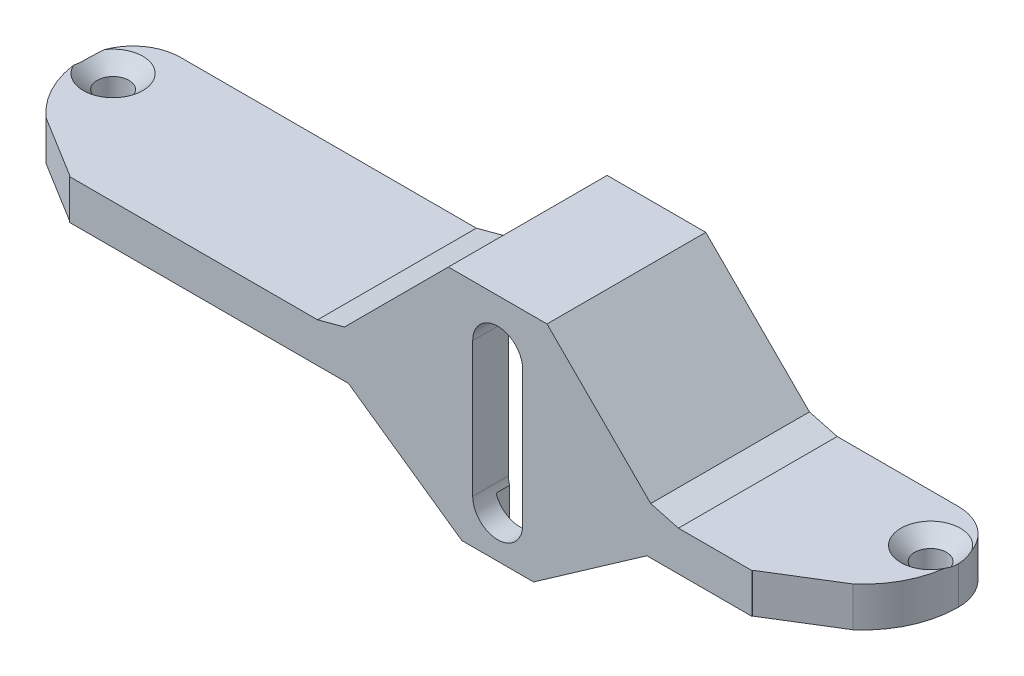
from build123d import *

# Parameters (mm, degrees)
BOSS_EXTRUDE1_DEPTH           = 3
CUT_EXTRUDE1_DEPTH            = 10
CUT_EXTRUDE3_START            = 8
SKETCH8_W                     = 6
SKETCH8_H                     = 3
CUT_EXTRUDE3_DEPTH            = 6
BOSS_EXTRUDE4_START           = 18
BOSS_EXTRUDE4_DEPTH           = 28
BOSS_EXTRUDE5_DEPTH           = 3
CUT_EXTRUDE4_DEPTH            = 3
CUT_EXTRUDE5_DEPTH            = 10
SKETCH18_R                    = 1.5
BOSS_EXTRUDE9_DEPTH           = 2
CHAMFER1_SIZE                 = 15
CHAMFER2_SIZE                 = 15
CHAMFER2_SIZE_2               = 10.503113073
CUT_EXTRUDE6_DEPTH            = 5
BOSS_EXTRUDE8_DEPTH           = 2
CHAMFER3_DEPTH                = 6
CHAMFER3_2_DEPTH              = 5
CSK_FOR_M4_SFHCS1_D           = 4
CSK_FOR_M4_SFHCS1_DEPTH       = 30.798278762
CSK_FOR_M4_SFHCS1_CSINK_D     = 7.5
CSK_FOR_M4_SFHCS1_CSINK_ANGLE = 90
CSK_FOR_M4_SFHCS1_TIP         = 1.201721238
CUT_EXTRUDE7_DEPTH            = 1.5
BOSS_EXTRUDE10_START          = -6
BOSS_EXTRUDE10_DEPTH          = 20
CHAMFER4_SIZE                 = 1.07179677
CHAMFER4_SIZE_2               = 4


with BuildPart() as part:
    # Sketch1 → Boss-Extrude1 (new body)
    with BuildSketch(Plane(origin=(0, 0, 0), x_dir=(1, 0, 0), z_dir=(0, 1, 0))):
        with BuildLine():
            ThreePointArc((-49, -6), (-53.242640687, -4.242640687), (-55, 0))
            ThreePointArc((-55, 0), (-51.485281374, -8.485281374), (-43, -12))
            Line((-43, -12), (43, -12))
            ThreePointArc((43, -12), (51.485281374, -8.485281374), (55, 0))
            ThreePointArc((55, 0), (53.242640687, -4.242640687), (49, -6))
            Line((49, -6), (-49, -6))
        make_face()
        with BuildLine():
            Line((-53, 0), (-55, 0))
            ThreePointArc((-55, 0), (-53.242640687, -4.242640687), (-49, -6))
            Line((-49, -6), (49, -6))
            ThreePointArc((49, -6), (53.242640687, -4.242640687), (55, 0))
            Line((55, 0), (53, 0))
            ThreePointArc((53, 0), (51.5, -1.5), (50, 0))
            Line((50, 0), (-50, 0))
            ThreePointArc((-50, 0), (-51.5, -1.5), (-53, 0))
        make_face()
        with BuildLine():
            Line((49, 6), (-49, 6))
            ThreePointArc((-49, 6), (-53.242640687, 4.242640687), (-55, 0))
            Line((-55, 0), (-53, 0))
            ThreePointArc((-53, 0), (-51.5, 1.5), (-50, 0))
            Line((-50, 0), (50, 0))
            ThreePointArc((50, 0), (51.5, 1.5), (53, 0))
            Line((53, 0), (55, 0))
            ThreePointArc((55, 0), (53.242640687, 4.242640687), (49, 6))
        make_face()
    extrude(amount=BOSS_EXTRUDE1_DEPTH)

    # Sketch2 → Cut-Extrude1 (cut)
    with BuildSketch(Plane(origin=(0, 3, 0), x_dir=(1, 0, 0), z_dir=(0, 1, 0))):
        Polygon((22, -8), (36, 6), (-14, 6), (0, -8), align=None)
    extrude(amount=-CUT_EXTRUDE1_DEPTH, mode=Mode.SUBTRACT)

    # Sketch8 → Cut-Extrude3 (cut)
    with BuildSketch(Plane.XY.offset(CUT_EXTRUDE3_START)):
        with Locations((10.960071178, 1.5)):
            Rectangle(SKETCH8_W, SKETCH8_H)
    extrude(amount=CUT_EXTRUDE3_DEPTH, mode=Mode.SUBTRACT)


with BuildPart() as cut_extrude3_piece_1:
    # of the separate pieces the step leaves, piece 1, a body of its own (cut_extrude3_pieces)
    add(part.part.solids().sort_by_distance((-55, 0, 0))[0])

    # Sketch9 → Boss-Extrude4 (add)
    with BuildSketch(Plane(origin=(0, 0, 0), x_dir=(1, 0, 0), z_dir=(0, 1, 0)).offset(BOSS_EXTRUDE4_START)):
        Polygon((13.960071178, -11.2), (13.960071178, -8), (14.760071178, -8), (14.760071178, -12), (7.160071178, -12), (7.160071178, -8), (7.960071178, -8), (7.960071178, -11.2), align=None)
    extrude(amount=-BOSS_EXTRUDE4_DEPTH)


with BuildPart() as cut_extrude3_piece_2:
    # of the separate pieces the step leaves, piece 2, a body of its own (cut_extrude3_pieces)
    add(part.part.solids().sort_by_distance((13.960071178, 0, 12))[0])


with BuildPart() as cut_extrude3_piece_1_1:
    add(cut_extrude3_piece_1.part)

    # Combine1: union Cut-Extrude3 piece 2
    add(cut_extrude3_piece_2.part)

    # Sketch11 → Boss-Extrude5 (add)
    with BuildSketch(Plane(origin=(0, 3, 0), x_dir=(1, 0, 0), z_dir=(0, 1, 0))):
        Polygon((-14, 6), (-12, 6), (2, -8), (0, -8), align=None)
        Polygon((20, -8), (34, 6), (36, 6), (22, -8), align=None)
    extrude(amount=-BOSS_EXTRUDE5_DEPTH)

    # Sketch13 → Cut-Extrude4 (cut)
    with BuildSketch(Plane(origin=(0, 3, 0), x_dir=(1, 0, 0), z_dir=(0, 1, 0))):
        Polygon((2, -8), (-2, -8), (-2, -4), align=None)
        Polygon((24, -4), (24, -8), (20, -8), align=None)
    extrude(amount=-CUT_EXTRUDE4_DEPTH, mode=Mode.SUBTRACT)

    # Sketch15 → Cut-Extrude5 (cut)
    with BuildSketch(Plane.XY.offset(12)):
        with BuildLine():
            Line((14.110071178, 12.5), (14.110071178, -4.5))
            ThreePointArc((14.110071178, -4.5), (10.960071178, -7.65), (7.810071178, -4.5))
            Line((7.810071178, -4.5), (7.810071178, 12.5))
            ThreePointArc((7.810071178, 12.5), (10.960071178, 15.65), (14.110071178, 12.5))
        make_face()
    extrude(amount=-CUT_EXTRUDE5_DEPTH, mode=Mode.SUBTRACT)

    # Sketch18 → Boss-Extrude9 (add)
    # profile 1 of 2: a face of its own
    with BuildSketch(Plane(origin=(0, 3, 0), x_dir=(1, 0, 0), z_dir=(0, 1, 0))):
        with BuildLine():
            Line((7.160071178, -8), (-2, -8))
            Line((-2, -8), (-2, -4))
            Line((-2, -4), (-12, 6))
            Line((-12, 6), (-49, 6))
            ThreePointArc((-49, 6), (-53.242640687, 4.242640687), (-55, 0))
            ThreePointArc((-55, 0), (-51.485281374, -8.485281374), (-43, -12))
            Line((-43, -12), (7.160071178, -12))
            Line((7.160071178, -12), (7.160071178, -8))
        make_face()
        with Locations(Location((-51.5, 0, 0), (0, 0, 270))):
            Circle(SKETCH18_R, mode=Mode.SUBTRACT)
    # profile 2 of 2: a face of its own
    with BuildSketch(Plane(origin=(0, 3, 0), x_dir=(1, 0, 0), z_dir=(0, 1, 0))):
        with BuildLine():
            Line((24, -4), (24, -8))
            Line((24, -8), (14.760071178, -8))
            Line((14.760071178, -8), (14.760071178, -12))
            Line((14.760071178, -12), (43, -12))
            ThreePointArc((43, -12), (51.485281374, -8.485281374), (55, 0))
            ThreePointArc((55, 0), (53.242640687, 4.242640687), (49, 6))
            Line((49, 6), (34, 6))
            Line((34, 6), (24, -4))
        make_face()
        with Locations(Location((51.5, 0, 0), (0, 0, 270))):
            Circle(SKETCH18_R, mode=Mode.SUBTRACT)
    extrude(amount=BOSS_EXTRUDE9_DEPTH)

    # Chamfer1
    # the kernel refuses this chamfer: 15 mm, written as the material it adds along each edge
    with BuildSketch(Plane(origin=(14.760071178, 5, 8), x_dir=(0, 1, 0), z_dir=(0, 0, 1))) as chamfer1_piece_1_section:
        Polygon((CHAMFER1_SIZE, 0), (0, -CHAMFER1_SIZE), (0, 0), align=None)
    chamfer1_piece_1 = extrude(amount=4, mode=Mode.PRIVATE)
    chamfer1_piece_1 = split(chamfer1_piece_1, bisect_by=Plane(origin=(14.760071178, 18, 8), z_dir=(0, -1, 0)), keep=Keep.TOP, mode=Mode.PRIVATE)
    chamfer1_piece_1 = split(chamfer1_piece_1, bisect_by=Plane(origin=(17.380035589, 5, 10.619964411), z_dir=(-0.7071067811865474, 0, -0.7071067811865477)), keep=Keep.TOP, mode=Mode.PRIVATE)
    add(chamfer1_piece_1)
    with BuildSketch(Plane(origin=(14.760071178, 5, -30.575244819), x_dir=(0, 1, 0), z_dir=(0, 0, 1))) as chamfer1_piece_2_section:
        Polygon((CHAMFER1_SIZE, 0), (0, -CHAMFER1_SIZE), (0, 0), align=None)
    chamfer1_piece_2 = extrude(amount=42.575244819, mode=Mode.PRIVATE)
    chamfer1_piece_2 = split(chamfer1_piece_2, bisect_by=Plane(origin=(14.760071178, 5, 8), z_dir=(0, 0, -1)), keep=Keep.TOP, mode=Mode.PRIVATE)
    chamfer1_piece_2 = split(chamfer1_piece_2, bisect_by=Plane(origin=(36.667657999, 5, -8.667657999), z_dir=(0.7071067811865474, 0, 0.7071067811865477)), keep=Keep.TOP, mode=Mode.PRIVATE)
    chamfer1_piece_2 = split(chamfer1_piece_2, bisect_by=Plane(origin=(24, 5, -30.575244819), z_dir=(1, 0, 0)), keep=Keep.TOP, mode=Mode.PRIVATE)
    add(chamfer1_piece_2)
    with BuildSketch(Plane(origin=(14.760071178, 5, 8), x_dir=(0, 1, 0), z_dir=(0, 0, 1))) as chamfer1_piece_3_section:
        Polygon((CHAMFER1_SIZE, 0), (0, -CHAMFER1_SIZE), (0, 0), align=None)
    chamfer1_piece_3 = extrude(amount=4, mode=Mode.PRIVATE)
    chamfer1_piece_3 = split(chamfer1_piece_3, bisect_by=Plane(origin=(14.760071178, 18, 8), z_dir=(0, -1, 0)), keep=Keep.TOP, mode=Mode.PRIVATE)
    chamfer1_piece_3 = split(chamfer1_piece_3, bisect_by=Plane(origin=(17.380035589, 5, 10.619964411), z_dir=(0.7071067811865474, 0, 0.7071067811865477)), keep=Keep.TOP, mode=Mode.PRIVATE)
    chamfer1_piece_3 = split(chamfer1_piece_3, bisect_by=Plane(origin=(24, 5, 8), z_dir=(-1, 0, 0)), keep=Keep.TOP, mode=Mode.PRIVATE)
    add(chamfer1_piece_3)
    with BuildSketch(Plane(origin=(14.760071178, 5, 8), x_dir=(0, 1, 0), z_dir=(0, 0, 1))) as chamfer1_piece_4_section:
        Polygon((CHAMFER1_SIZE, 0), (0, -CHAMFER1_SIZE), (0, 0), align=None)
    chamfer1_piece_4 = extrude(amount=4, mode=Mode.PRIVATE)
    chamfer1_piece_4 = split(chamfer1_piece_4, bisect_by=Plane(origin=(24, 5, 8), z_dir=(1, 0, 0)), keep=Keep.TOP, mode=Mode.PRIVATE)
    add(chamfer1_piece_4)
    with BuildSketch(Plane(origin=(7.160071178, 5, 12), x_dir=(0, 1, 0), z_dir=(0, 0, -1))) as chamfer1_piece_5_section:
        Polygon((CHAMFER1_SIZE, 0), (0, -CHAMFER1_SIZE), (0, 0), align=None)
    chamfer1_piece_5 = extrude(amount=4, mode=Mode.PRIVATE)
    chamfer1_piece_5 = split(chamfer1_piece_5, bisect_by=Plane(origin=(6.580035589, 5, 12.580035589), z_dir=(-0.7071067811865489, 0, 0.7071067811865461)), keep=Keep.TOP, mode=Mode.PRIVATE)
    chamfer1_piece_5 = split(chamfer1_piece_5, bisect_by=Plane(origin=(-2, 5, 12), z_dir=(1, 0, 0)), keep=Keep.TOP, mode=Mode.PRIVATE)
    chamfer1_piece_5 = split(chamfer1_piece_5, bisect_by=Plane(origin=(7.160071178, 18, 12), z_dir=(0, -1, 0)), keep=Keep.TOP, mode=Mode.PRIVATE)
    add(chamfer1_piece_5)
    with BuildSketch(Plane(origin=(7.160071178, 5, 12), x_dir=(0, 1, 0), z_dir=(0, 0, -1))) as chamfer1_piece_6_section:
        Polygon((CHAMFER1_SIZE, 0), (0, -CHAMFER1_SIZE), (0, 0), align=None)
    chamfer1_piece_6 = extrude(amount=4, mode=Mode.PRIVATE)
    chamfer1_piece_6 = split(chamfer1_piece_6, bisect_by=Plane(origin=(-2, 5, 12), z_dir=(-1, 0, 0)), keep=Keep.TOP, mode=Mode.PRIVATE)
    add(chamfer1_piece_6)
    with BuildSketch(Plane(origin=(7.160071178, 5, 12), x_dir=(0, 1, 0), z_dir=(0, 0, -1))) as chamfer1_piece_7_section:
        Polygon((CHAMFER1_SIZE, 0), (0, -CHAMFER1_SIZE), (0, 0), align=None)
    chamfer1_piece_7 = extrude(amount=4, mode=Mode.PRIVATE)
    chamfer1_piece_7 = split(chamfer1_piece_7, bisect_by=Plane(origin=(6.580035589, 5, 12.580035589), z_dir=(0.7071067811865489, 0, -0.7071067811865461)), keep=Keep.TOP, mode=Mode.PRIVATE)
    chamfer1_piece_7 = split(chamfer1_piece_7, bisect_by=Plane(origin=(7.160071178, 18, 12), z_dir=(0, -1, 0)), keep=Keep.TOP, mode=Mode.PRIVATE)
    add(chamfer1_piece_7)
    with BuildSketch(Plane(origin=(7.160071178, 5, 12), x_dir=(0, 1, 0), z_dir=(0, 0, -1))) as chamfer1_piece_8_section:
        Polygon((CHAMFER1_SIZE, 0), (0, -CHAMFER1_SIZE), (0, 0), align=None)
    chamfer1_piece_8 = extrude(amount=42.575244819, mode=Mode.PRIVATE)
    chamfer1_piece_8 = split(chamfer1_piece_8, bisect_by=Plane(origin=(6.580035589, 5, 12.580035589), z_dir=(-0.7071067811865489, 0, 0.7071067811865461)), keep=Keep.TOP, mode=Mode.PRIVATE)
    chamfer1_piece_8 = split(chamfer1_piece_8, bisect_by=Plane(origin=(-2, 5, 12), z_dir=(-1, 0, 0)), keep=Keep.TOP, mode=Mode.PRIVATE)
    chamfer1_piece_8 = split(chamfer1_piece_8, bisect_by=Plane(origin=(7.160071178, 5, 8), z_dir=(0, 0, -1)), keep=Keep.TOP, mode=Mode.PRIVATE)
    add(chamfer1_piece_8)

    # Chamfer2
    # the kernel refuses this chamfer: 15, 10.503113073 mm, written as the material it adds along each edge
    with BuildSketch(Plane(origin=(7.160071178, 0, 12), x_dir=(-1, 0, 0), z_dir=(0, 0, -1))) as chamfer2_piece_1_section:
        Polygon((CHAMFER2_SIZE, 0), (0, -CHAMFER2_SIZE_2), (0, 0), align=None)
    chamfer2_piece_1 = extrude(amount=4, mode=Mode.PRIVATE)
    chamfer2_piece_1 = split(chamfer2_piece_1, bisect_by=Plane(origin=(-2, 0, 12), z_dir=(-1, 0, 0)), keep=Keep.TOP, mode=Mode.PRIVATE)
    add(chamfer2_piece_1)
    with BuildSketch(Plane(origin=(7.160071178, 0, 12), x_dir=(-1, 0, 0), z_dir=(0, 0, -1))) as chamfer2_piece_2_section:
        Polygon((CHAMFER2_SIZE, 0), (0, -CHAMFER2_SIZE_2), (0, 0), align=None)
    chamfer2_piece_2 = extrude(amount=4, mode=Mode.PRIVATE)
    chamfer2_piece_2 = split(chamfer2_piece_2, bisect_by=Plane(origin=(6.580035589, 0, 12.580035589), z_dir=(-0.7071067811865476, 0, 0.7071067811865476)), keep=Keep.TOP, mode=Mode.PRIVATE)
    chamfer2_piece_2 = split(chamfer2_piece_2, bisect_by=Plane(origin=(-2, 0, 12), z_dir=(1, 0, 0)), keep=Keep.TOP, mode=Mode.PRIVATE)
    add(chamfer2_piece_2)
    with BuildSketch(Plane(origin=(7.160071178, 0, 12), x_dir=(-1, 0, 0), z_dir=(0, 0, -1))) as chamfer2_piece_3_section:
        Polygon((CHAMFER2_SIZE, 0), (0, -CHAMFER2_SIZE_2), (0, 0), align=None)
    chamfer2_piece_3 = extrude(amount=42.738283454, mode=Mode.PRIVATE)
    chamfer2_piece_3 = split(chamfer2_piece_3, bisect_by=Plane(origin=(6.580035589, 0, 12.580035589), z_dir=(-0.7071067811865476, 0, 0.7071067811865476)), keep=Keep.TOP, mode=Mode.PRIVATE)
    chamfer2_piece_3 = split(chamfer2_piece_3, bisect_by=Plane(origin=(7.160071178, 0, 8), z_dir=(0, 0, -1)), keep=Keep.TOP, mode=Mode.PRIVATE)
    chamfer2_piece_3 = split(chamfer2_piece_3, bisect_by=Plane(origin=(-2, 0, 12), z_dir=(-1, 0, 0)), keep=Keep.TOP, mode=Mode.PRIVATE)
    add(chamfer2_piece_3)
    with BuildSketch(Plane(origin=(7.160071178, 0, 12), x_dir=(-1, 0, 0), z_dir=(0, 0, -1))) as chamfer2_piece_4_section:
        Polygon((CHAMFER2_SIZE, 0), (0, -CHAMFER2_SIZE_2), (0, 0), align=None)
    chamfer2_piece_4 = extrude(amount=4, mode=Mode.PRIVATE)
    chamfer2_piece_4 = split(chamfer2_piece_4, bisect_by=Plane(origin=(6.580035589, 0, 12.580035589), z_dir=(0.7071067811865476, 0, -0.7071067811865476)), keep=Keep.TOP, mode=Mode.PRIVATE)
    chamfer2_piece_4 = split(chamfer2_piece_4, bisect_by=Plane(origin=(7.160071178, -10, 12), z_dir=(0, 1, 0)), keep=Keep.TOP, mode=Mode.PRIVATE)
    add(chamfer2_piece_4)
    with BuildSketch(Plane(origin=(14.760071178, 0, 12), x_dir=(0, -1, 0), z_dir=(0, 0, -1))) as chamfer2_piece_5_section:
        Polygon((CHAMFER2_SIZE_2, 0), (0, -CHAMFER2_SIZE), (0, 0), align=None)
    chamfer2_piece_5 = extrude(amount=4, mode=Mode.PRIVATE)
    chamfer2_piece_5 = split(chamfer2_piece_5, bisect_by=Plane(origin=(15.380035589, 0, 12.619964411), z_dir=(0.7071067811865476, 0, 0.7071067811865476)), keep=Keep.TOP, mode=Mode.PRIVATE)
    chamfer2_piece_5 = split(chamfer2_piece_5, bisect_by=Plane(origin=(24, 0, 12), z_dir=(-1, 0, 0)), keep=Keep.TOP, mode=Mode.PRIVATE)
    add(chamfer2_piece_5)
    with BuildSketch(Plane(origin=(14.760071178, 0, 12), x_dir=(0, -1, 0), z_dir=(0, 0, -1))) as chamfer2_piece_6_section:
        Polygon((CHAMFER2_SIZE_2, 0), (0, -CHAMFER2_SIZE), (0, 0), align=None)
    chamfer2_piece_6 = extrude(amount=4, mode=Mode.PRIVATE)
    chamfer2_piece_6 = split(chamfer2_piece_6, bisect_by=Plane(origin=(24, 0, 12), z_dir=(1, 0, 0)), keep=Keep.TOP, mode=Mode.PRIVATE)
    add(chamfer2_piece_6)
    with BuildSketch(Plane(origin=(14.760071178, 0, 12), x_dir=(0, -1, 0), z_dir=(0, 0, -1))) as chamfer2_piece_7_section:
        Polygon((CHAMFER2_SIZE_2, 0), (0, -CHAMFER2_SIZE), (0, 0), align=None)
    chamfer2_piece_7 = extrude(amount=4, mode=Mode.PRIVATE)
    chamfer2_piece_7 = split(chamfer2_piece_7, bisect_by=Plane(origin=(14.760071178, -10, 12), z_dir=(0, 1, 0)), keep=Keep.TOP, mode=Mode.PRIVATE)
    chamfer2_piece_7 = split(chamfer2_piece_7, bisect_by=Plane(origin=(15.380035589, 0, 12.619964411), z_dir=(-0.7071067811865476, 0, -0.7071067811865476)), keep=Keep.TOP, mode=Mode.PRIVATE)
    add(chamfer2_piece_7)
    with BuildSketch(Plane(origin=(14.760071178, 0, 12), x_dir=(0, -1, 0), z_dir=(0, 0, -1))) as chamfer2_piece_8_section:
        Polygon((CHAMFER2_SIZE_2, 0), (0, -CHAMFER2_SIZE), (0, 0), align=None)
    chamfer2_piece_8 = extrude(amount=42.738283454, mode=Mode.PRIVATE)
    chamfer2_piece_8 = split(chamfer2_piece_8, bisect_by=Plane(origin=(14.760071178, 0, 8), z_dir=(0, 0, -1)), keep=Keep.TOP, mode=Mode.PRIVATE)
    chamfer2_piece_8 = split(chamfer2_piece_8, bisect_by=Plane(origin=(15.380035589, 0, 12.619964411), z_dir=(0.7071067811865476, 0, 0.7071067811865476)), keep=Keep.TOP, mode=Mode.PRIVATE)
    chamfer2_piece_8 = split(chamfer2_piece_8, bisect_by=Plane(origin=(24, 0, 12), z_dir=(1, 0, 0)), keep=Keep.TOP, mode=Mode.PRIVATE)
    add(chamfer2_piece_8)

    # Sketch16 → Cut-Extrude6 (cut)
    with BuildSketch(Plane(origin=(0, 0, 0), x_dir=(1, 0, 0), z_dir=(0, 1, 0))):
        Polygon((-7.839928822, 1.839928822), (-2, -4), (-2, -8), (-7.839928822, -8), align=None)
        Polygon((24, -8), (24, -4), (29.760071178, 1.760071178), (29.760071178, -8), align=None)
    extrude(amount=-CUT_EXTRUDE6_DEPTH, mode=Mode.SUBTRACT)

    # Sketch17 → Boss-Extrude8 (add)
    with BuildSketch(Plane.XY.offset(12)):
        Polygon((6.441551245, -10), (15.47859111, -10), (29.760071178, 0), (43, 0), (43, 5), (29.760071178, 5), (16.760071178, 18), (5.160071178, 18), (-7.839928822, 5), (-43, 5), (-43, 0), (-7.839928822, 0), align=None)
        with BuildLine():
            Line((7.810071178, 12.5), (7.810071178, -4.5))
            ThreePointArc((7.810071178, -4.5), (10.960071178, -7.65), (14.110071178, -4.5))
            Line((14.110071178, -4.5), (14.110071178, 12.5))
            ThreePointArc((14.110071178, 12.5), (10.960071178, 15.65), (7.810071178, 12.5))
        make_face(mode=Mode.SUBTRACT)
    extrude(amount=BOSS_EXTRUDE8_DEPTH)

    # Chamfer3: read off the stored shape, not the designer's step
    # Chamfer3 outline → Chamfer3 (cut)
    with BuildSketch(Plane(origin=(0, 0, 0), x_dir=(1, 0, 0), z_dir=(0, 1, 0))):
        with BuildLine():
            ThreePointArc((47.608318931, -11.079864468), (49.300429772, -10.212961602), (50.834384089, -9.08968789))
            Line((50.834384089, -9.08968789), (47.608318931, -11.079864468))
        make_face()
        with BuildLine():
            ThreePointArc((-50.834384089, -9.08968789), (-49.300429772, -10.212961602), (-47.608318931, -11.079864468))
            Line((-47.608318931, -11.079864468), (-50.834384089, -9.08968789))
        make_face()
    extrude(amount=CHAMFER3_DEPTH, mode=Mode.SUBTRACT)

    # Chamfer3 2 outline → Chamfer3 2 (add)
    with BuildSketch(Plane(origin=(0, 0, 0), x_dir=(1, 0, 0), z_dir=(0, 1, 0))):
        with BuildLine():
            Line((43, -13.922760673), (47.608318931, -11.079864468))
            ThreePointArc((47.608318931, -11.079864468), (45.349641077, -11.767717995), (43, -12))
            Line((43, -12), (43, -13.922760673))
        make_face()
        with BuildLine():
            Line((-47.608318931, -11.079864468), (-43, -13.922760673))
            Line((-43, -13.922760673), (-43, -12))
            ThreePointArc((-43, -12), (-45.349641077, -11.767717995), (-47.608318931, -11.079864468))
        make_face()
    extrude(amount=CHAMFER3_2_DEPTH)

    # CSK for M4 SFHCS1
    with Locations(Plane(origin=(0, 5, 0), x_dir=(1, 0, 0), z_dir=(0, 1, 0))):
        with Locations((-51.5, 0), (51.5, 0)):
            CounterSinkHole(CSK_FOR_M4_SFHCS1_D / 2, CSK_FOR_M4_SFHCS1_CSINK_D / 2, depth=CSK_FOR_M4_SFHCS1_DEPTH, counter_sink_angle=CSK_FOR_M4_SFHCS1_CSINK_ANGLE)
            with Locations((0, 0, -(CSK_FOR_M4_SFHCS1_DEPTH + CSK_FOR_M4_SFHCS1_TIP / 2))):  # 118° drill point
                Cone(0, CSK_FOR_M4_SFHCS1_D / 2, CSK_FOR_M4_SFHCS1_TIP, mode=Mode.SUBTRACT)

    # Sketch21 → Cut-Extrude7 (cut)
    with BuildSketch(Plane(origin=(0, 0, 8), x_dir=(-1, 0, 0), z_dir=(0, 0, -1))):
        Polygon((-13.960071178, -10), (-13.960071178, 18), (-16.760071178, 18), (-16.760071178, -9.102697997), (-15.47859111, -10), align=None)
        Polygon((-7.960071178, -10), (-7.960071178, 18), (-5.160071178, 18), (-5.160071178, -9.102697997), (-6.441551245, -10), align=None)
    extrude(amount=-CUT_EXTRUDE7_DEPTH, mode=Mode.SUBTRACT)

    # Sketch22 → Boss-Extrude10 (add)
    with BuildSketch(Plane.XY.offset(BOSS_EXTRUDE10_START)):
        Polygon((34, 3), (28.931644053, 3), (15.931644053, 16), (5.988498302, 16), (-7.011501698, 3), (-12, 3), (-12, 6), (-8.254142385, 6), (4.745857615, 19), (17.17428474, 19), (30.17428474, 6), (34, 6), align=None)
    extrude(amount=BOSS_EXTRUDE10_DEPTH)

    # Chamfer4
    # the kernel refuses this chamfer: 4, 1.07179677 mm, written as the material it takes off along each edge
    with BuildSketch(Plane(origin=(-12, 6, -16.386886281), x_dir=(0, -1, 0), z_dir=(0, 0, 1))) as chamfer4_piece_1_section:
        Polygon((CHAMFER4_SIZE, 0), (0, CHAMFER4_SIZE_2), (0, 0), align=None)
    chamfer4_piece_1 = extrude(amount=40.773772562, mode=Mode.PRIVATE)
    chamfer4_piece_1 = split(chamfer4_piece_1, bisect_by=Plane(origin=(-12, 5, -16.386886281), z_dir=(0, 1, 0)), keep=Keep.TOP, mode=Mode.PRIVATE)
    chamfer4_piece_1 = split(chamfer4_piece_1, bisect_by=Plane(origin=(-10.127071192, 4.127071192, -16.386886281), z_dir=(-0.707106781186548, 0.7071067811865472, 0)), keep=Keep.TOP, mode=Mode.PRIVATE)
    add(chamfer4_piece_1, mode=Mode.SUBTRACT)
    with BuildSketch(Plane(origin=(34, 6, -16.386886281), x_dir=(-1, 0, 0), z_dir=(0, 0, 1))) as chamfer4_piece_2_section:
        Polygon((CHAMFER4_SIZE_2, 0), (0, CHAMFER4_SIZE), (0, 0), align=None)
    chamfer4_piece_2 = extrude(amount=40.773772562, mode=Mode.PRIVATE)
    chamfer4_piece_2 = split(chamfer4_piece_2, bisect_by=Plane(origin=(34, 5, -16.386886281), z_dir=(0, 1, 0)), keep=Keep.TOP, mode=Mode.PRIVATE)
    chamfer4_piece_2 = split(chamfer4_piece_2, bisect_by=Plane(origin=(32.08714237, 4.08714237, -16.386886281), z_dir=(0.7071067811865475, 0.7071067811865476, 0)), keep=Keep.TOP, mode=Mode.PRIVATE)
    add(chamfer4_piece_2, mode=Mode.SUBTRACT)


solid = cut_extrude3_piece_1_1.part
